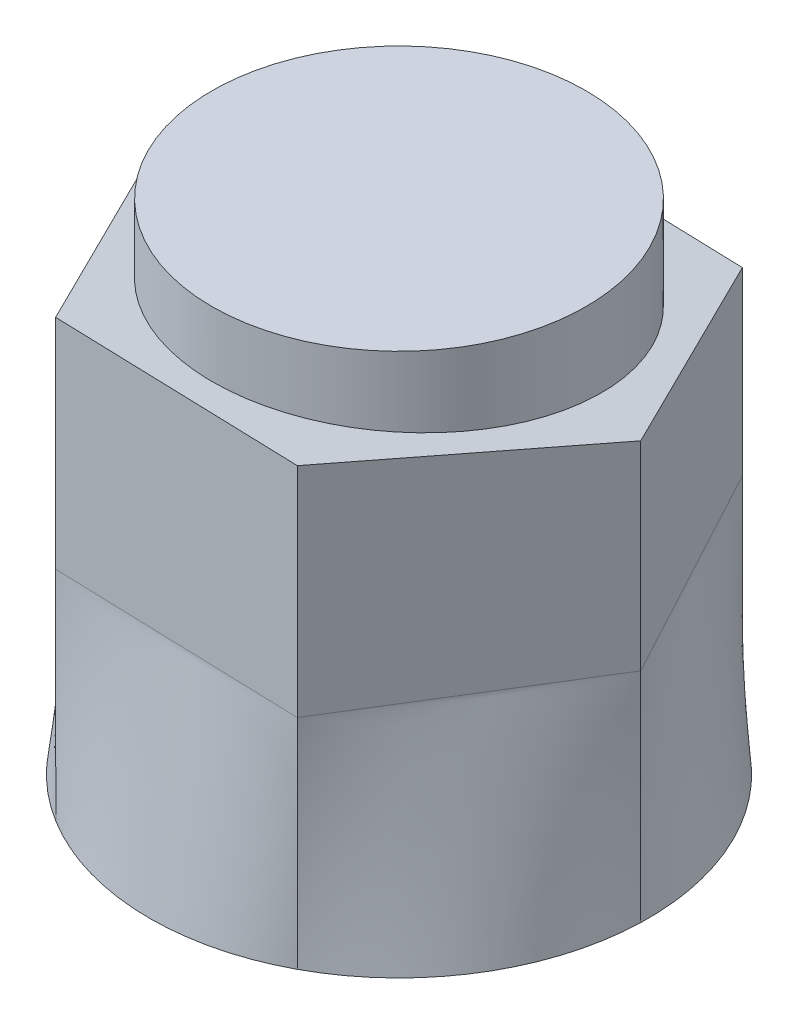
from build123d import *

# Parameters (mm, degrees)
BOSS_EXTRUDE1_DEPTH      = 11.1125
DRAFT2_START             = 21.18139532
DRAFT2_OUTLINE_W         = 28
DRAFT2_OUTLINE_H         = 26
DRAFT2_DEPTH             = 1.91806369
BOSS_EXTRUDE2_DEPTH      = 3.175
BOSS_EXTRUDE2_DEPTH_BACK = 3.175
SKETCH7_R                = 9.525


# Read off the part's stored shape, not the designer's step: Draft2
with BuildPart() as part:
    # Sketch3 → Loft1 section 0
    with BuildSketch(Plane(origin=(0, 11.1125, 0), x_dir=(1, 0, 0), z_dir=(0, 1, 0))):
        with BuildLine():
            Line((6.01391392, -11.192562017), (12.7, -0.388078778))
            Line((12.7, -0.388078778), (6.68608608, 10.804483239))
            Line((6.68608608, 10.804483239), (-6.01391392, 11.192562017))
            Line((-6.01391392, 11.192562017), (-12.7, 0.388078778))
            Line((-12.7, 0.388078778), (-6.68608608, -10.804483239))
            Line((-6.68608608, -10.804483239), (6.01391392, -11.192562017))
        make_face()
    # Sketch2 for Loft1 → Loft1 section 1
    with BuildSketch(Plane(origin=(0, 0, 0), x_dir=(1, 0, 0), z_dir=(0, 1, 0))):
        with BuildLine():
            # circular arc as an exact rational Bezier (weights 1, cos(half-angle), 1)
            Bezier((6.011108127, -11.187340126), (12.47012196, -7.716825231), (12.694074813, -0.38789772), weights=[1, 0.866025404, 1])
            Bezier((12.694074813, -0.38789772), (12.918027667, 6.941029791), (6.682966686, 10.799442406), weights=[1, 0.866025404, 1])
            Bezier((6.682966686, 10.799442406), (0.447905706, 14.65785502), (-6.011108127, 11.187340126), weights=[1, 0.866025404, 1])
            Bezier((-6.011108127, 11.187340126), (-12.47012196, 7.716825231), (-12.694074813, 0.38789772), weights=[1, 0.866025404, 1])
            Bezier((-12.694074813, 0.38789772), (-12.918027667, -6.941029791), (-6.682966686, -10.799442406), weights=[1, 0.866025404, 1])
            Bezier((-6.682966686, -10.799442406), (-0.447905706, -14.65785502), (6.011108127, -11.187340126), weights=[1, 0.866025404, 1])
        make_face()
    loft()

    # Sketch3<2> → Boss-Extrude1 (add)
    with BuildSketch(Plane(origin=(0, 11.1125, 0), x_dir=(1, 0, 0), z_dir=(0, 1, 0))):
        Polygon((6.01391392, -11.192562017), (12.7, -0.388078778), (6.68608608, 10.804483239), (-6.01391392, 11.192562017), (-12.7, 0.388078778), (-6.68608608, -10.804483239), align=None)
    extrude(amount=BOSS_EXTRUDE1_DEPTH)

    # Draft2 outline → Draft2 (cut)
    with BuildSketch(Plane(origin=(0, 0, 0), x_dir=(0.999996456847854, -0.002651888614820864, 0.00023190194633995566), z_dir=(0.00266200896657633, 0.9961946980917459, -0.0871150802224119)).offset(DRAFT2_START)):
        with Locations((0, -2)):
            Rectangle(DRAFT2_OUTLINE_W, DRAFT2_OUTLINE_H)
    extrude(amount=DRAFT2_DEPTH, mode=Mode.SUBTRACT)

    # Sketch7 → Boss-Extrude2 (add, two sides: drawn at the far end of the back side and taken through both)
    with BuildSketch(Plane(origin=(0, 22.225, 0), x_dir=(1, 0, 0), z_dir=(0, 1, 0)).offset(-BOSS_EXTRUDE2_DEPTH_BACK)):
        with Locations(Location((0, 0, 0), (0, 0, 270))):
            Circle(SKETCH7_R)
    extrude(amount=BOSS_EXTRUDE2_DEPTH + BOSS_EXTRUDE2_DEPTH_BACK)


solid = part.part
